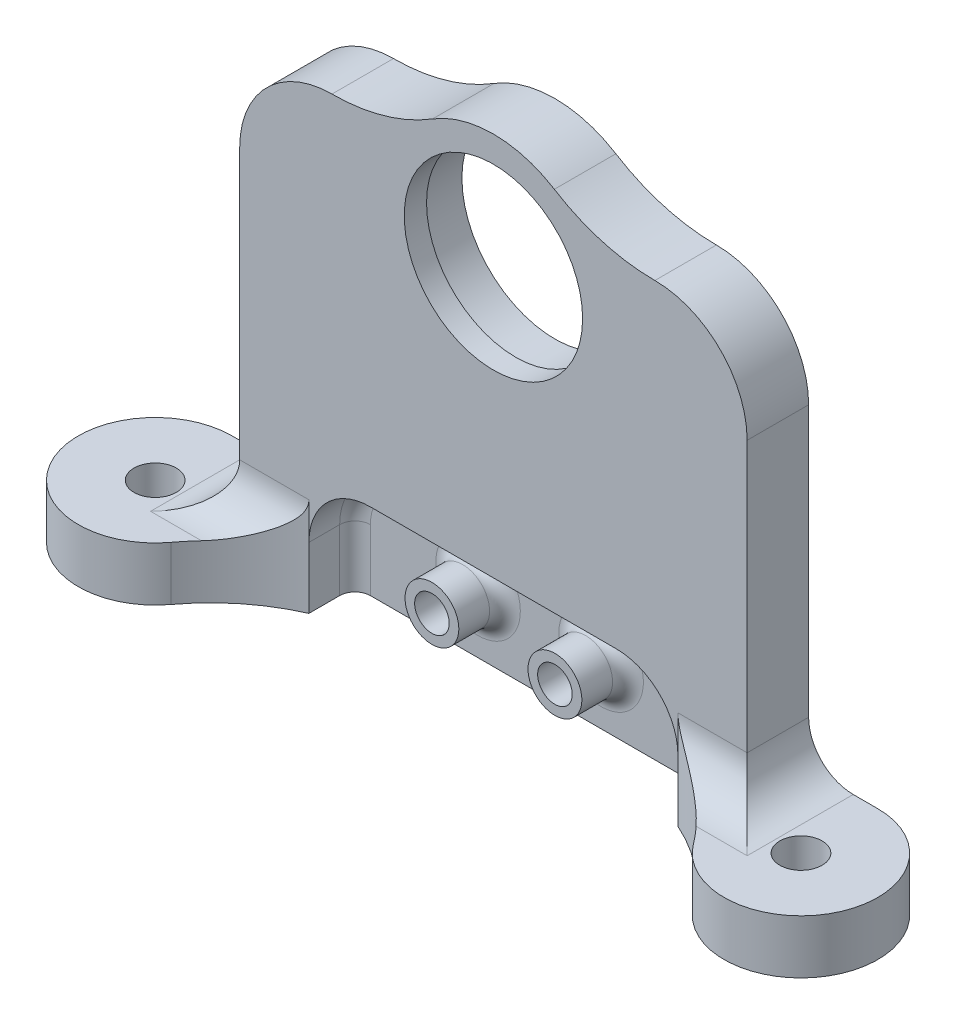
from build123d import *

# Parameters (mm, degrees)
SKETCH1_W           = 33
SKETCH1_H           = 66
BOSS_EXTRUDE1_DEPTH = 8
SKETCH3_R           = 11.6
CUT_EXTRUDE1_DEPTH  = 62.269894728
SKETCH6_R           = 12.1
CUT_EXTRUDE2_DEPTH  = 5.1
SKETCH10_R          = 2.75
BOSS_EXTRUDE4_DEPTH = 7
CUT_EXTRUDE3_DEPTH  = 6
SKETCH12_R          = 2.75
CUT_EXTRUDE4_DEPTH  = 6
FILLET7_R           = 2
FILLET5_R           = 25
FILLET6_R           = 5.8
SKETCH13_R          = 3.5
SKETCH13_R_2        = 2.25
BOSS_EXTRUDE5_DEPTH = 8
FILLET8_R           = 2
CUT_EXTRUDE5_DEPTH  = 76.531450471


with BuildPart() as part:
    # Sketch1 → Boss-Extrude1 (new body)
    with BuildSketch(Plane.XY):
        with Locations((16.5, -18)):
            Rectangle(SKETCH1_W, SKETCH1_H)
    extrude(amount=BOSS_EXTRUDE1_DEPTH)

    # Sketch3 → Cut-Extrude1 (cut, through all)
    with BuildSketch(Plane.XY.offset(8)):
        Circle(SKETCH3_R)
    extrude(amount=-CUT_EXTRUDE1_DEPTH, mode=Mode.SUBTRACT)

    # Sketch6 → Cut-Extrude2 (cut)
    with BuildSketch(Plane(origin=(0, 0, 0), x_dir=(-1, 0, 0), z_dir=(0, 0, -1))):
        Circle(SKETCH6_R)
    extrude(amount=-CUT_EXTRUDE2_DEPTH, mode=Mode.SUBTRACT)

    # Sketch10 → Boss-Extrude4 (add)
    with BuildSketch(Plane.XZ.offset(51)):
        with BuildLine():
            Line((42, 0), (32, 0))
            Line((32, 0), (32, 10))
            ThreePointArc((32, 10), (49.071067812, 17.071067812), (42, 0))
        make_face()
        with Locations(Location((42, 10, 0), (0, 0, 270))):
            Circle(SKETCH10_R, mode=Mode.SUBTRACT)
    extrude(amount=-BOSS_EXTRUDE4_DEPTH)

    # Sketch11 → Cut-Extrude3 (cut)
    with BuildSketch(Plane.XY.offset(8)):
        with BuildLine():
            Line((0, -51), (24, -51))
            Line((24, -51), (24, -43))
            ThreePointArc((24, -43), (21.656854249, -37.343145751), (16, -35))
            Line((16, -35), (0, -35))
            Line((0, -35), (0, -51))
        make_face()
    extrude(amount=-CUT_EXTRUDE3_DEPTH, mode=Mode.SUBTRACT)

    # Sketch12 → Cut-Extrude4 (cut)
    with BuildSketch(Plane.XY.offset(2)):
        with Locations((8, -43)):
            Circle(SKETCH12_R)
    extrude(amount=-CUT_EXTRUDE4_DEPTH, mode=Mode.SUBTRACT)

    # Fillet7
    fillet7_edges = [part.edges().sort_by_distance(p)[0] for p in [
        (8, -35, 2),
        (21.656854249, -37.343145751, 2),
        (24, -47, 2),
    ]]
    fillet(fillet7_edges, radius=FILLET7_R)

    # Fillet5
    # the kernel refuses this fillet: 25 mm, written as the material it adds along each edge
    with BuildSketch(Plane(origin=(32, -44, 8), x_dir=(-1, 0, 0), z_dir=(0, -1, 0))) as fillet5_piece_1:
        with BuildLine():
            CenterArc((18.096713956, -22.870425604), FILLET5_R, 113.820244592, 29.574545381)
            Line((-1.972367441, -7.962978744), (-3.979275581, -6.472234058))
            ThreePointArc((-3.979275581, -6.472234058), (-2.5, -2), (-2.5, 0))
            Line((-2.5, 0), (0, 2.5))
            ThreePointArc((0, 2.5), (4, 2.5), (6.990328604, 2.28704256))
            Line((6.990328604, 2.28704256), (8, 0))
        make_face()
    extrude(amount=7)

    # Fillet6
    # the kernel refuses this fillet: 5.8 mm, written as the material it adds along each edge
    with BuildSketch(Plane(origin=(33, -44, 0), x_dir=(0, 1, 0), z_dir=(0, 0, 1))) as fillet6_piece_1:
        with BuildLine():
            CenterArc((FILLET6_R, -FILLET6_R), FILLET6_R, 90, 90)
            Line((0, -FILLET6_R), (0, 0))
            Line((0, 0), (FILLET6_R, 0))
        make_face()
    extrude(amount=8)
    with BuildSketch(Plane(origin=(33, -44, 8), x_dir=(0, 1, 0), z_dir=(-1, 0, 0))) as fillet6_piece_2_section:
        with BuildLine():
            CenterArc((FILLET6_R, -FILLET6_R), FILLET6_R, 90, 90)
            Line((0, -FILLET6_R), (0, 0))
            Line((0, 0), (FILLET6_R, 0))
        make_face()
    fillet6_piece_2 = extrude(amount=23.5, mode=Mode.PRIVATE)
    fillet6_piece_2 = fillet6_piece_2 - Plane(origin=(13.903286044, -44, 30.870425604), x_dir=(-1, 0, 0), z_dir=(0, 1, 0)) * Cylinder(25, 71, mode=Mode.PRIVATE)
    add(fillet6_piece_2)
    with BuildSketch(Plane(origin=(47.5, -44, 8), x_dir=(0, 1, 0), z_dir=(-1, 0, 0))) as fillet6_piece_3a_section:
        with BuildLine():
            CenterArc((FILLET6_R, -FILLET6_R), FILLET6_R, 90, 90)
            Line((0, -FILLET6_R), (0, 0))
            Line((0, 0), (FILLET6_R, 0))
        make_face()
    fillet6_piece_3a = extrude(amount=23.5, mode=Mode.PRIVATE)
    fillet6_piece_3a = fillet6_piece_3a - Plane(origin=(42, -44, 10), x_dir=(0, 0, -1), z_dir=(0, -1, 0)) * Cylinder(2.75, 71, mode=Mode.PRIVATE)
    fillet6_piece_3a = split(fillet6_piece_3a, bisect_by=Plane(origin=(33, -44, 8), z_dir=(1, 0, 0)), keep=Keep.TOP, mode=Mode.PRIVATE)
    with BuildSketch(Plane(origin=(33, -44, 0), x_dir=(0, 1, 0), z_dir=(0, 0, 1))) as fillet6_piece_3b_section:
        with BuildLine():
            CenterArc((FILLET6_R, -FILLET6_R), FILLET6_R, 90, 90)
            Line((0, -FILLET6_R), (0, 0))
            Line((0, 0), (FILLET6_R, 0))
        make_face()
    fillet6_piece_3b = extrude(amount=22.5, mode=Mode.PRIVATE)
    fillet6_piece_3b = split(fillet6_piece_3b, bisect_by=Plane(origin=(33, -44, 8), z_dir=(0, 0, 1)), keep=Keep.TOP, mode=Mode.PRIVATE)
    fillet6_piece_3b = fillet6_piece_3b & Plane(origin=(42, -44, 10), x_dir=(-1, 0, 0), z_dir=(0, -1, 0)) * Cylinder(10, 69, mode=Mode.PRIVATE)
    fillet6_piece_3 = fillet6_piece_3a & fillet6_piece_3b
    add(fillet6_piece_3)

    # Sketch13 → Boss-Extrude5 (add)
    with BuildSketch(Plane(origin=(0, 0, 0), x_dir=(-1, 0, 0), z_dir=(0, 0, -1))):
        with Locations((-8, -43)):
            Circle(SKETCH13_R)
        with Locations((-8, -43)):
            Circle(SKETCH13_R_2, mode=Mode.SUBTRACT)
    extrude(amount=-BOSS_EXTRUDE5_DEPTH)

    # Fillet8
    fillet8_edges = [part.edges().sort_by_distance(p)[0] for p in [
        (11.5, -43, 2),
    ]]
    fillet(fillet8_edges, radius=FILLET8_R)

    # Sketch15 → Cut-Extrude5 (cut, through all)
    with BuildSketch(Plane(origin=(0, 0, 0), x_dir=(-1, 0, 0), z_dir=(0, 0, -1))):
        with BuildLine():
            Line((0, 15), (-33, 15))
            Line((-33, 15), (-33, -3))
            ThreePointArc((-33, -3), (-29.485281374, 5.485281374), (-21, 9))
            ThreePointArc((-21, 9), (-14.200652085, 9.952282296), (-7.924528302, 12.735849057))
            ThreePointArc((-7.924528302, 12.735849057), (-4.120816918, 14.422859215), (0, 15))
        make_face()
    extrude(amount=-CUT_EXTRUDE5_DEPTH, mode=Mode.SUBTRACT)

    # Mirror1: part across plane


with BuildPart() as part_1:
    add(part.part)
    add(part.part.mirror(Plane(origin=(0, 15, 8), x_dir=(0, 0, 1), z_dir=(1, 0, 0))))


solid = part_1.part
